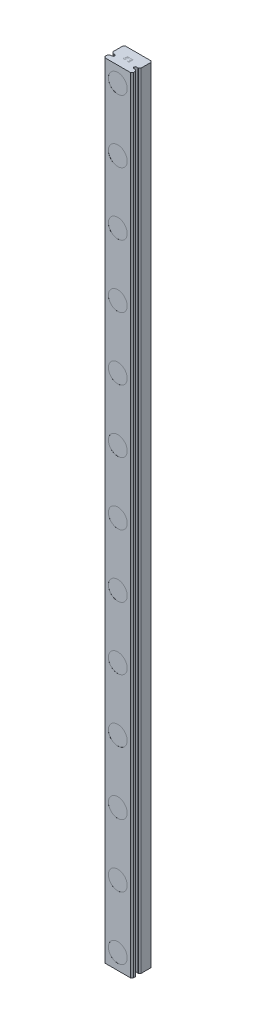
from build123d import *

# Parameters (mm, degrees)
BOSS_EXTRUDE1_DEPTH               = 250
CUT_EXTRUDE1_DEPTH                = 251.124968766
CUT_EXTRUDE2_DEPTH                = 251.124968766
CUT_EXTRUDE3_DEPTH                = 251.124968766
CUT_EXTRUDE4_DEPTH                = 251.124968766
CUT_EXTRUDE5_DEPTH                = 251.124968766
CUT_EXTRUDE6_DEPTH                = 251.124968766
CUT_EXTRUDE7_DEPTH                = 0.002166667
CUT_EXTRUDE8_DEPTH                = 0.002166667
CUT_EXTRUDE9_DEPTH                = 0.002166667
CUT_EXTRUDE10_DEPTH               = 0.002166667
DRAFT1_ANGLE                      = 45.1469538
SKETCH12_W                        = 3
SKETCH12_H                        = 0.01000002
SKETCH13_W                        = 3
SKETCH13_H                        = 0.01000002
SKETCH14_W                        = 3
SKETCH14_H                        = 0.01000002
SKETCH15_W                        = 3
SKETCH15_H                        = 0.01000002
SKETCH16_W                        = 3
SKETCH16_H                        = 0.01000002
SKETCH17_W                        = 3
SKETCH17_H                        = 0.01000002
SKETCH18_W                        = 3
SKETCH18_H                        = 0.01000002
SKETCH19_W                        = 3
SKETCH19_H                        = 0.01000002
SKETCH20_W                        = 3
SKETCH20_H                        = 0.01000002
SKETCH21_W                        = 3
SKETCH21_H                        = 0.01000002
SKETCH22_W                        = 3
SKETCH22_H                        = 0.01000002
SKETCH23_W                        = 3
SKETCH23_H                        = 0.01000002
SKETCH24_W                        = 3
SKETCH24_H                        = 0.01000002
SKETCH25_W                        = 0.450000002
SKETCH25_H                        = 250
SKETCH26_W                        = 0.450000001
SKETCH26_H                        = 250
M3_5X0_6_TAPPED_HOLE1_AT_2_COUNT  = 2
M3_5X0_6_TAPPED_HOLE1_AT_2_PITCH  = 20
M3_5X0_6_TAPPED_HOLE1_AT_3_COUNT  = 2
M3_5X0_6_TAPPED_HOLE1_AT_3_PITCH  = 40
M3_5X0_6_TAPPED_HOLE1_AT_4_COUNT  = 2
M3_5X0_6_TAPPED_HOLE1_AT_4_PITCH  = 60
M3_5X0_6_TAPPED_HOLE1_AT_5_COUNT  = 2
M3_5X0_6_TAPPED_HOLE1_AT_5_PITCH  = 80
M3_5X0_6_TAPPED_HOLE1_AT_6_COUNT  = 2
M3_5X0_6_TAPPED_HOLE1_AT_6_PITCH  = 100
M3_5X0_6_TAPPED_HOLE1_AT_7_COUNT  = 2
M3_5X0_6_TAPPED_HOLE1_AT_7_PITCH  = 120
M3_5X0_6_TAPPED_HOLE1_AT_8_COUNT  = 2
M3_5X0_6_TAPPED_HOLE1_AT_8_PITCH  = 140
M3_5X0_6_TAPPED_HOLE1_AT_9_COUNT  = 2
M3_5X0_6_TAPPED_HOLE1_AT_9_PITCH  = 160
M3_5X0_6_TAPPED_HOLE1_AT_10_COUNT = 2
M3_5X0_6_TAPPED_HOLE1_AT_10_PITCH = 180
M3_5X0_6_TAPPED_HOLE1_AT_11_COUNT = 2
M3_5X0_6_TAPPED_HOLE1_AT_11_PITCH = 200
M3_5X0_6_TAPPED_HOLE1_AT_12_COUNT = 2
M3_5X0_6_TAPPED_HOLE1_AT_12_PITCH = 220
M3_5X0_6_TAPPED_HOLE1_AT_13_COUNT = 2
M3_5X0_6_TAPPED_HOLE1_AT_13_PITCH = 240
CHAMFER1_SIZE                     = 0.4
CHAMFER2_START                    = -3.730761794
CHAMFER2_DEPTH                    = 0.399013115
CHAMFER3_SIZE                     = 0.062563219
CHAMFER3_SIZE_2                   = 0.030809797
CHAMFER4_SIZE                     = 0.070998461
CHAMFER4_SIZE2                    = 0.069869378
CHAMFER5_START                    = 0.691347976
CHAMFER5_DEPTH                    = 0.551558805
FILLET1_R                         = 0.130000023


with BuildPart() as part:
    # Sketch1 → Boss-Extrude1 (new body)
    with BuildSketch(Plane.XZ):
        Polygon((4.5, 0), (4.5, 6.01167813), (4.1, 6.50000002), (-4.1, 6.50000002), (-4.5, 6.01167813), (-4.5, 0), align=None)
    extrude(amount=-BOSS_EXTRUDE1_DEPTH)

    # Sketch2 → Cut-Extrude1 (cut, through all)
    with BuildSketch(Plane(origin=(0, 250, 0), x_dir=(-1, 0, 0), z_dir=(0, 1, 0))):
        with BuildLine():
            Line((-4.5, 4.88017535), (-4.5, 4.03150278))
            Line((-4.5, 4.03150278), (-3.66946318, 4.03150278))
            ThreePointArc((-3.66946318, 4.03150278), (-3.969667593, 4.455839065), (-3.66946318, 4.88017535))
            Line((-3.66946318, 4.88017535), (-4.5, 4.88017535))
        make_face()
    extrude(amount=-CUT_EXTRUDE1_DEPTH, mode=Mode.SUBTRACT)

    # Sketch3 → Cut-Extrude2 (cut, through all)
    with BuildSketch(Plane(origin=(0, 250, 0), x_dir=(-1, 0, 0), z_dir=(0, 1, 0))):
        with BuildLine():
            Line((-4.026513856, 4.03150278), (-4.5, 4.03150278))
            Line((-4.5, 4.03150278), (-4.5, 3.583620931))
            ThreePointArc((-4.5, 3.583620931), (-4.223645982, 3.76568645), (-4.026513856, 4.03150278))
        make_face()
    extrude(amount=-CUT_EXTRUDE2_DEPTH, mode=Mode.SUBTRACT)

    # Sketch4 → Cut-Extrude3 (cut, through all)
    with BuildSketch(Plane(origin=(0, 250, 0), x_dir=(-1, 0, 0), z_dir=(0, 1, 0))):
        with BuildLine():
            Line((-4.5, 5.328056964), (-4.5, 4.88017535))
            Line((-4.5, 4.88017535), (-4.026513974, 4.88017535))
            ThreePointArc((-4.026513974, 4.88017535), (-4.223646078, 5.145991535), (-4.5, 5.328056964))
        make_face()
    extrude(amount=-CUT_EXTRUDE3_DEPTH, mode=Mode.SUBTRACT)

    # Sketch5 → Cut-Extrude4 (cut, through all)
    with BuildSketch(Plane(origin=(0, 250, 0), x_dir=(-1, 0, 0), z_dir=(0, 1, 0))):
        with BuildLine():
            Line((4.5, 4.03150278), (4.5, 4.88017535))
            Line((4.5, 4.88017535), (3.66946318, 4.88017535))
            ThreePointArc((3.66946318, 4.88017535), (3.969667593, 4.455839065), (3.66946318, 4.03150278))
            Line((3.66946318, 4.03150278), (4.5, 4.03150278))
        make_face()
    extrude(amount=-CUT_EXTRUDE4_DEPTH, mode=Mode.SUBTRACT)

    # Sketch6 → Cut-Extrude5 (cut, through all)
    with BuildSketch(Plane(origin=(0, 250, 0), x_dir=(-1, 0, 0), z_dir=(0, 1, 0))):
        with BuildLine():
            Line((4.026513826, 4.88017535), (4.5, 4.88017535))
            Line((4.5, 4.88017535), (4.5, 5.328057255))
            ThreePointArc((4.5, 5.328057255), (4.223645966, 5.145991706), (4.026513826, 4.88017535))
        make_face()
    extrude(amount=-CUT_EXTRUDE5_DEPTH, mode=Mode.SUBTRACT)

    # Sketch7 → Cut-Extrude6 (cut, through all)
    with BuildSketch(Plane(origin=(0, 250, 0), x_dir=(-1, 0, 0), z_dir=(0, 1, 0))):
        with BuildLine():
            Line((4.5, 3.583620926), (4.5, 4.03150278))
            Line((4.5, 4.03150278), (4.026513851, 4.03150278))
            ThreePointArc((4.026513851, 4.03150278), (4.223645987, 3.765686455), (4.5, 3.583620926))
        make_face()
    extrude(amount=-CUT_EXTRUDE6_DEPTH, mode=Mode.SUBTRACT)

    # Sketch8 → Cut-Extrude7 (cut)
    with BuildSketch(Plane(origin=(0, 250, 0), x_dir=(-1, 0, 0), z_dir=(0, 1, 0))):
        Polygon((0.891369267, 3.403698133), (0.714701433, 3.168235633), (0.2187042, 2.61105), (1.0945792, 2.61105), (1.0945792, 2.695983333), (0.398689633, 2.695983333), (0.794326433, 3.149466667), (0.9743123, 3.3891), (1.067110588, 3.573407857), (0.95413722, 3.802321701), (0.7876908, 3.88505), (0.54301, 3.88505), (0.375434678, 3.803592619), (0.295011167, 3.6384023), (0.295011167, 3.562), (0.3812718, 3.562), (0.3812718, 3.631766667), (0.437672733, 3.743620833), (0.549645633, 3.800116667), (0.7802262, 3.800116667), (0.893028067, 3.743810633), (0.976240026, 3.576039029), align=None)
    extrude(amount=-CUT_EXTRUDE7_DEPTH, mode=Mode.SUBTRACT)

    # Sketch9 → Cut-Extrude8 (cut)
    with BuildSketch(Plane.XZ):
        Polygon((-0.214632167, 3.88505), (-0.953983333, 3.88505), (-0.953983333, 2.61105), (-0.214632167, 2.61105), (-0.214632167, 2.695983333), (-0.86905, 2.695983333), (-0.86905, 3.205583333), (-0.5123963, 3.205583333), (-0.5123963, 3.290516667), (-0.86905, 3.290516667), (-0.86905, 3.800116667), (-0.214632167, 3.800116667), align=None)
    extrude(amount=-CUT_EXTRUDE8_DEPTH, mode=Mode.SUBTRACT)

    # Sketch10 → Cut-Extrude9 (cut)
    with BuildSketch(Plane(origin=(0, 250, 0), x_dir=(-1, 0, 0), z_dir=(0, 1, 0))):
        Polygon((-0.214632167, 3.88505), (-0.953983333, 3.88505), (-0.953983333, 2.61105), (-0.214632167, 2.61105), (-0.214632167, 2.695983333), (-0.86905, 2.695983333), (-0.86905, 3.205583333), (-0.5123963, 3.205583333), (-0.5123963, 3.290516667), (-0.86905, 3.290516667), (-0.86905, 3.800116667), (-0.214632167, 3.800116667), align=None)
    extrude(amount=-CUT_EXTRUDE9_DEPTH, mode=Mode.SUBTRACT)

    # Sketch11 → Cut-Extrude10 (cut)
    with BuildSketch(Plane.XZ):
        Polygon((0.510057167, 3.620830633), (0.6071, 3.718655633), (0.6071, 2.609403333), (0.692033333, 2.609403333), (0.692033333, 3.883403333), (0.6741176, 3.883403333), (0.6741176, 3.795069794), (0.3690544, 3.640736667), (0.3690544, 3.551253333), align=None)
    extrude(amount=-CUT_EXTRUDE10_DEPTH, mode=Mode.SUBTRACT)

    # Draft1
    draft1_faces = [part.faces().sort_by_distance(p)[0] for p in [
        (0.6741176, 0.001083333, 3.839236564),
    ]]
    draft(draft1_faces, Plane(origin=(0.692033333, 0.002166667, 3.883403333), x_dir=(-1, 0, 0), z_dir=(0, 0, -1)), DRAFT1_ANGLE)

    # Sketch12 → Cut-Revolve1 (revolve, cut)
    with BuildSketch(Plane.XZ.offset(-5), mode=Mode.PRIVATE) as cut_revolve1_sk:
        with Locations((1.5, 6.49500001)):
            Rectangle(SKETCH12_W, SKETCH12_H)
    revolve(cut_revolve1_sk.sketch.rotate(Axis((0, 5, 6.50000002), (0, 0, -1)), 180), axis=Axis((0, 5, 6.50000002), (0, 0, -1)), mode=Mode.SUBTRACT)

    # Sketch13 → Cut-Revolve2 (revolve, cut)
    with BuildSketch(Plane.XZ.offset(-25), mode=Mode.PRIVATE) as cut_revolve2_sk:
        with Locations((1.5, 6.49500001)):
            Rectangle(SKETCH13_W, SKETCH13_H)
    revolve(cut_revolve2_sk.sketch.rotate(Axis((0, 25, 6.50000002), (0, 0, -1)), 180), axis=Axis((0, 25, 6.50000002), (0, 0, -1)), mode=Mode.SUBTRACT)

    # Sketch14 → Cut-Revolve3 (revolve, cut)
    with BuildSketch(Plane.XZ.offset(-45), mode=Mode.PRIVATE) as cut_revolve3_sk:
        with Locations((1.5, 6.49500001)):
            Rectangle(SKETCH14_W, SKETCH14_H)
    revolve(cut_revolve3_sk.sketch.rotate(Axis((0, 45, 6.50000002), (0, 0, -1)), 180), axis=Axis((0, 45, 6.50000002), (0, 0, -1)), mode=Mode.SUBTRACT)

    # Sketch15 → Cut-Revolve4 (revolve, cut)
    with BuildSketch(Plane.XZ.offset(-65), mode=Mode.PRIVATE) as cut_revolve4_sk:
        with Locations((1.5, 6.49500001)):
            Rectangle(SKETCH15_W, SKETCH15_H)
    revolve(cut_revolve4_sk.sketch.rotate(Axis((0, 65, 6.50000002), (0, 0, -1)), 180), axis=Axis((0, 65, 6.50000002), (0, 0, -1)), mode=Mode.SUBTRACT)

    # Sketch16 → Cut-Revolve5 (revolve, cut)
    with BuildSketch(Plane.XZ.offset(-85), mode=Mode.PRIVATE) as cut_revolve5_sk:
        with Locations((1.5, 6.49500001)):
            Rectangle(SKETCH16_W, SKETCH16_H)
    revolve(cut_revolve5_sk.sketch.rotate(Axis((0, 85, 6.50000002), (0, 0, -1)), 180), axis=Axis((0, 85, 6.50000002), (0, 0, -1)), mode=Mode.SUBTRACT)

    # Sketch17 → Cut-Revolve6 (revolve, cut)
    with BuildSketch(Plane.XZ.offset(-105), mode=Mode.PRIVATE) as cut_revolve6_sk:
        with Locations((1.5, 6.49500001)):
            Rectangle(SKETCH17_W, SKETCH17_H)
    revolve(cut_revolve6_sk.sketch.rotate(Axis((0, 105, 6.50000002), (0, 0, -1)), 180), axis=Axis((0, 105, 6.50000002), (0, 0, -1)), mode=Mode.SUBTRACT)

    # Sketch18 → Cut-Revolve7 (revolve, cut)
    with BuildSketch(Plane.XZ.offset(-125), mode=Mode.PRIVATE) as cut_revolve7_sk:
        with Locations((1.5, 6.49500001)):
            Rectangle(SKETCH18_W, SKETCH18_H)
    revolve(cut_revolve7_sk.sketch.rotate(Axis((0, 125, 6.50000002), (0, 0, -1)), 180), axis=Axis((0, 125, 6.50000002), (0, 0, -1)), mode=Mode.SUBTRACT)

    # Sketch19 → Cut-Revolve8 (revolve, cut)
    with BuildSketch(Plane.XZ.offset(-145), mode=Mode.PRIVATE) as cut_revolve8_sk:
        with Locations((1.5, 6.49500001)):
            Rectangle(SKETCH19_W, SKETCH19_H)
    revolve(cut_revolve8_sk.sketch.rotate(Axis((0, 145, 6.50000002), (0, 0, -1)), 180), axis=Axis((0, 145, 6.50000002), (0, 0, -1)), mode=Mode.SUBTRACT)

    # Sketch20 → Cut-Revolve9 (revolve, cut)
    with BuildSketch(Plane.XZ.offset(-165), mode=Mode.PRIVATE) as cut_revolve9_sk:
        with Locations((1.5, 6.49500001)):
            Rectangle(SKETCH20_W, SKETCH20_H)
    revolve(cut_revolve9_sk.sketch.rotate(Axis((0, 165, 6.50000002), (0, 0, -1)), 180), axis=Axis((0, 165, 6.50000002), (0, 0, -1)), mode=Mode.SUBTRACT)

    # Sketch21 → Cut-Revolve10 (revolve, cut)
    with BuildSketch(Plane.XZ.offset(-185), mode=Mode.PRIVATE) as cut_revolve10_sk:
        with Locations((1.5, 6.49500001)):
            Rectangle(SKETCH21_W, SKETCH21_H)
    revolve(cut_revolve10_sk.sketch.rotate(Axis((0, 185, 6.50000002), (0, 0, -1)), 180), axis=Axis((0, 185, 6.50000002), (0, 0, -1)), mode=Mode.SUBTRACT)

    # Sketch22 → Cut-Revolve11 (revolve, cut)
    with BuildSketch(Plane.XZ.offset(-205), mode=Mode.PRIVATE) as cut_revolve11_sk:
        with Locations((1.5, 6.49500001)):
            Rectangle(SKETCH22_W, SKETCH22_H)
    revolve(cut_revolve11_sk.sketch.rotate(Axis((0, 205, 6.50000002), (0, 0, -1)), 180), axis=Axis((0, 205, 6.50000002), (0, 0, -1)), mode=Mode.SUBTRACT)

    # Sketch23 → Cut-Revolve12 (revolve, cut)
    with BuildSketch(Plane.XZ.offset(-225), mode=Mode.PRIVATE) as cut_revolve12_sk:
        with Locations((1.5, 6.49500001)):
            Rectangle(SKETCH23_W, SKETCH23_H)
    revolve(cut_revolve12_sk.sketch.rotate(Axis((0, 225, 6.50000002), (0, 0, -1)), 180), axis=Axis((0, 225, 6.50000002), (0, 0, -1)), mode=Mode.SUBTRACT)

    # Sketch24 → Cut-Revolve13 (revolve, cut)
    with BuildSketch(Plane.XZ.offset(-245), mode=Mode.PRIVATE) as cut_revolve13_sk:
        with Locations((1.5, 6.49500001)):
            Rectangle(SKETCH24_W, SKETCH24_H)
    revolve(cut_revolve13_sk.sketch.rotate(Axis((0, 245, 6.50000002), (0, 0, -1)), 180), axis=Axis((0, 245, 6.50000002), (0, 0, -1)), mode=Mode.SUBTRACT)

    # Sketch25 → Cut-Revolve14 (revolve, cut)
    with BuildSketch(Plane(origin=(0, 0, 4.455839065), x_dir=(-1, 0, 0), z_dir=(0, 0, -1))):
        with Locations((-3.744667592, 125)):
            Rectangle(SKETCH25_W, SKETCH25_H)
    revolve(axis=Axis((3.519667591, 0, 4.455839065), (0, 1, 0)), mode=Mode.SUBTRACT)

    # Sketch26 → Cut-Revolve15 (revolve, cut)
    with BuildSketch(Plane.XY.offset(4.455839065)):
        with Locations((-3.294667591, 125)):
            Rectangle(SKETCH26_W, SKETCH26_H)
    revolve(axis=Axis((-3.519667591, 250, 4.455839065), (0, -1, 0)), mode=Mode.SUBTRACT)

    # Sketch27 → M3.5x0.6 Tapped Hole1 (revolve, cut)
    with BuildSketch(Plane(origin=(0, 245, 0), x_dir=(0, 1, 0), z_dir=(1, 0, 0))):
        Polygon((0, 0), (0, 6.09), (3, 6.09), (3, 3), (1.75, 3), (1.75, 0), align=None)
    m3_5x0_6_tapped_hole1 = revolve(axis=Axis((0, 245, -6.35), (0, 0, 1)), mode=Mode.SUBTRACT)

    # M3.5x0.6 Tapped Hole1 at 2: M3.5x0.6 Tapped Hole1 ×2
    with Locations(*[(0, -i * M3_5X0_6_TAPPED_HOLE1_AT_2_PITCH, 0) for i in range(1, M3_5X0_6_TAPPED_HOLE1_AT_2_COUNT)]):
        add(m3_5x0_6_tapped_hole1, mode=Mode.SUBTRACT)

    # M3.5x0.6 Tapped Hole1 at 3: M3.5x0.6 Tapped Hole1 ×2
    with Locations(*[(0, -i * M3_5X0_6_TAPPED_HOLE1_AT_3_PITCH, 0) for i in range(1, M3_5X0_6_TAPPED_HOLE1_AT_3_COUNT)]):
        add(m3_5x0_6_tapped_hole1, mode=Mode.SUBTRACT)

    # M3.5x0.6 Tapped Hole1 at 4: M3.5x0.6 Tapped Hole1 ×2
    with Locations(*[(0, -i * M3_5X0_6_TAPPED_HOLE1_AT_4_PITCH, 0) for i in range(1, M3_5X0_6_TAPPED_HOLE1_AT_4_COUNT)]):
        add(m3_5x0_6_tapped_hole1, mode=Mode.SUBTRACT)

    # M3.5x0.6 Tapped Hole1 at 5: M3.5x0.6 Tapped Hole1 ×2
    with Locations(*[(0, -i * M3_5X0_6_TAPPED_HOLE1_AT_5_PITCH, 0) for i in range(1, M3_5X0_6_TAPPED_HOLE1_AT_5_COUNT)]):
        add(m3_5x0_6_tapped_hole1, mode=Mode.SUBTRACT)

    # M3.5x0.6 Tapped Hole1 at 6: M3.5x0.6 Tapped Hole1 ×2
    with Locations(*[(0, -i * M3_5X0_6_TAPPED_HOLE1_AT_6_PITCH, 0) for i in range(1, M3_5X0_6_TAPPED_HOLE1_AT_6_COUNT)]):
        add(m3_5x0_6_tapped_hole1, mode=Mode.SUBTRACT)

    # M3.5x0.6 Tapped Hole1 at 7: M3.5x0.6 Tapped Hole1 ×2
    with Locations(*[(0, -i * M3_5X0_6_TAPPED_HOLE1_AT_7_PITCH, 0) for i in range(1, M3_5X0_6_TAPPED_HOLE1_AT_7_COUNT)]):
        add(m3_5x0_6_tapped_hole1, mode=Mode.SUBTRACT)

    # M3.5x0.6 Tapped Hole1 at 8: M3.5x0.6 Tapped Hole1 ×2
    with Locations(*[(0, -i * M3_5X0_6_TAPPED_HOLE1_AT_8_PITCH, 0) for i in range(1, M3_5X0_6_TAPPED_HOLE1_AT_8_COUNT)]):
        add(m3_5x0_6_tapped_hole1, mode=Mode.SUBTRACT)

    # M3.5x0.6 Tapped Hole1 at 9: M3.5x0.6 Tapped Hole1 ×2
    with Locations(*[(0, -i * M3_5X0_6_TAPPED_HOLE1_AT_9_PITCH, 0) for i in range(1, M3_5X0_6_TAPPED_HOLE1_AT_9_COUNT)]):
        add(m3_5x0_6_tapped_hole1, mode=Mode.SUBTRACT)

    # M3.5x0.6 Tapped Hole1 at 10: M3.5x0.6 Tapped Hole1 ×2
    with Locations(*[(0, -i * M3_5X0_6_TAPPED_HOLE1_AT_10_PITCH, 0) for i in range(1, M3_5X0_6_TAPPED_HOLE1_AT_10_COUNT)]):
        add(m3_5x0_6_tapped_hole1, mode=Mode.SUBTRACT)

    # M3.5x0.6 Tapped Hole1 at 11: M3.5x0.6 Tapped Hole1 ×2
    with Locations(*[(0, -i * M3_5X0_6_TAPPED_HOLE1_AT_11_PITCH, 0) for i in range(1, M3_5X0_6_TAPPED_HOLE1_AT_11_COUNT)]):
        add(m3_5x0_6_tapped_hole1, mode=Mode.SUBTRACT)

    # M3.5x0.6 Tapped Hole1 at 12: M3.5x0.6 Tapped Hole1 ×2
    with Locations(*[(0, -i * M3_5X0_6_TAPPED_HOLE1_AT_12_PITCH, 0) for i in range(1, M3_5X0_6_TAPPED_HOLE1_AT_12_COUNT)]):
        add(m3_5x0_6_tapped_hole1, mode=Mode.SUBTRACT)

    # M3.5x0.6 Tapped Hole1 at 13: M3.5x0.6 Tapped Hole1 ×2
    with Locations(*[(0, -i * M3_5X0_6_TAPPED_HOLE1_AT_13_PITCH, 0) for i in range(1, M3_5X0_6_TAPPED_HOLE1_AT_13_COUNT)]):
        add(m3_5x0_6_tapped_hole1, mode=Mode.SUBTRACT)

    # Chamfer1
    chamfer1_edges = [part.edges().sort_by_distance(p)[0] for p in [
        (-4.5, 125, 0),
        (4.5, 125, 0),
    ]]
    chamfer(chamfer1_edges, length=CHAMFER1_SIZE)

    # Chamfer2: read off the stored shape, not the designer's step
    # Chamfer2 outline → Chamfer2 (add)
    with BuildSketch(Plane(origin=(0, 0, 0), x_dir=(0.8991051825477069, 0, 0.43773264753254887), z_dir=(0.4377326475325489, 0, -0.8991051825477068)).offset(CHAMFER2_START)):
        Polygon((1.327401403, -249.997833333), (1.31122788, -249.997833333), (1.311999664, -250), (1.327401403, -250), align=None)
    extrude(amount=CHAMFER2_DEPTH)

    # Chamfer3
    # the kernel refuses this chamfer: 0.146507754, 0.062563219, 0.062205617, 0.030809797 mm, written as the material it adds along each edge
    # the kernel refuses this chamfer: 0.146507754, 0.062563219, 0.062205617, 0.030809797 mm, written as the material it takes off along each edge
    with BuildSketch(Plane(origin=(-0.821026488, 250, 3.888979914), x_dir=(0.8958618252622427, 0, -0.4443327469788859), z_dir=(-0.444332746978886, 0, -0.8958618252622429))) as chamfer3_2_piece_1_section:
        Polygon((CHAMFER3_SIZE * 1.00000000721, 0), (0, CHAMFER3_SIZE_2 * 0.999999991295), (0, 0), align=None)
    chamfer3_2_piece_1 = extrude(amount=0.511362527, mode=Mode.PRIVATE)
    chamfer3_2_piece_1 = split(chamfer3_2_piece_1, bisect_by=Plane(origin=(-0.812856417, 250, 3.872542019), z_dir=(0.4450822124591343, 0, -0.8954897119188373)), keep=Keep.TOP, mode=Mode.PRIVATE)
    chamfer3_2_piece_1 = split(chamfer3_2_piece_1, bisect_by=Plane(origin=(-1.069976281, 250, 3.766382443), z_dir=(0.8971170149860217, 0, 0.4417930074396494)), keep=Keep.TOP, mode=Mode.PRIVATE)
    chamfer3_2_piece_1 = split(chamfer3_2_piece_1, bisect_by=Plane(origin=(-0.821026488, 249.997833333, 3.888979914), z_dir=(0, 1, 0)), keep=Keep.TOP, mode=Mode.PRIVATE)
    add(chamfer3_2_piece_1, mode=Mode.SUBTRACT)

    # Chamfer4
    chamfer4_edges = [part.edges().sort_by_distance(p)[0] for p in [
        (-1.067110588, 249.998916667, 3.573407857),
    ]]
    chamfer4_side = [part.faces().sort_by_distance(p)[0] for p in [
        (-1.010623904, 249.998916667, 3.687864779),
    ]]
    chamfer(chamfer4_edges, length=CHAMFER4_SIZE, length2=CHAMFER4_SIZE2, reference=chamfer4_side[0])

    # Chamfer5: read off the stored shape, not the designer's step
    # Chamfer5 outline → Chamfer5 (add)
    with BuildSketch(Plane(origin=(0, 0, 0), x_dir=(0.4450822124591335, 0, -0.8954897119188376), z_dir=(0.8954897119188375, 0, 0.4450822124591337)).offset(CHAMFER5_START)):
        Polygon((-3.829609469, 249.997833333), (-3.813890258, 249.997833333), (-3.814601826, 250), (-3.829609469, 250), align=None)
    extrude(amount=CHAMFER5_DEPTH)

    # Fillet1
    fillet1_edges = [part.edges().sort_by_distance(p)[0] for p in [
        (4.026513856, 125, 4.03150278),
        (4.5, 125, 3.583620931),
        (4.5, 125, 5.328056964),
        (4.026513974, 125, 4.88017535),
        (-4.026513826, 125, 4.88017535),
        (-4.5, 125, 5.328057255),
        (-4.5, 125, 3.583620926),
        (-4.026513851, 125, 4.03150278),
    ]]
    fillet(fillet1_edges, radius=FILLET1_R)


solid = part.part
